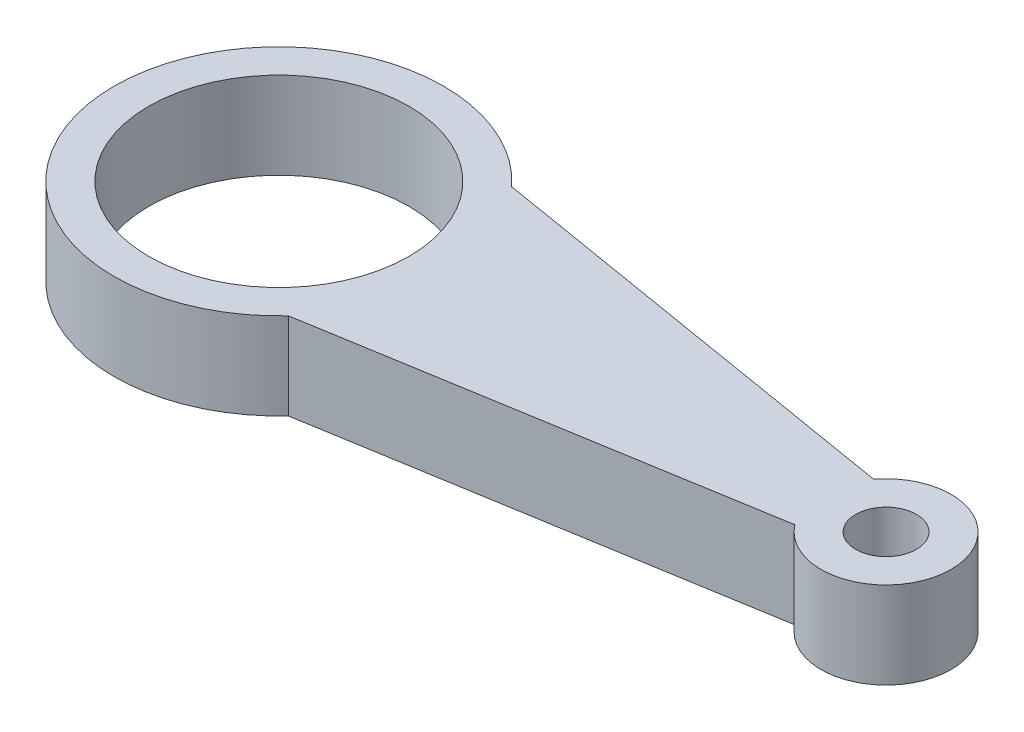
from build123d import *

# Parameters (mm, degrees)
SKETCH1_R           = 30
SKETCH1_R_2         = 7
BOSS_EXTRUDE1_DEPTH = 10


with BuildPart() as part:
    # Sketch1 → Boss-Extrude1 (new, symmetric)
    with BuildSketch(Plane(origin=(0, 0, 0), x_dir=(1, 0, 0), z_dir=(0, 1, 0))):
        with BuildLine():
            Line((27.935473676, 25.760615491), (128.063755469, 9.084385863))
            ThreePointArc((128.063755469, 9.084385863), (155, 0), (128.063755469, -9.084385863))
            Line((128.063755469, -9.084385863), (27.935473676, -25.760615491))
            ThreePointArc((27.935473676, -25.760615491), (-38, 0), (27.935473676, 25.760615491))
        make_face()
        Circle(SKETCH1_R, mode=Mode.SUBTRACT)
        with Locations((140, 0)):
            Circle(SKETCH1_R_2, mode=Mode.SUBTRACT)
    extrude(amount=BOSS_EXTRUDE1_DEPTH, both=True)


solid = part.part
